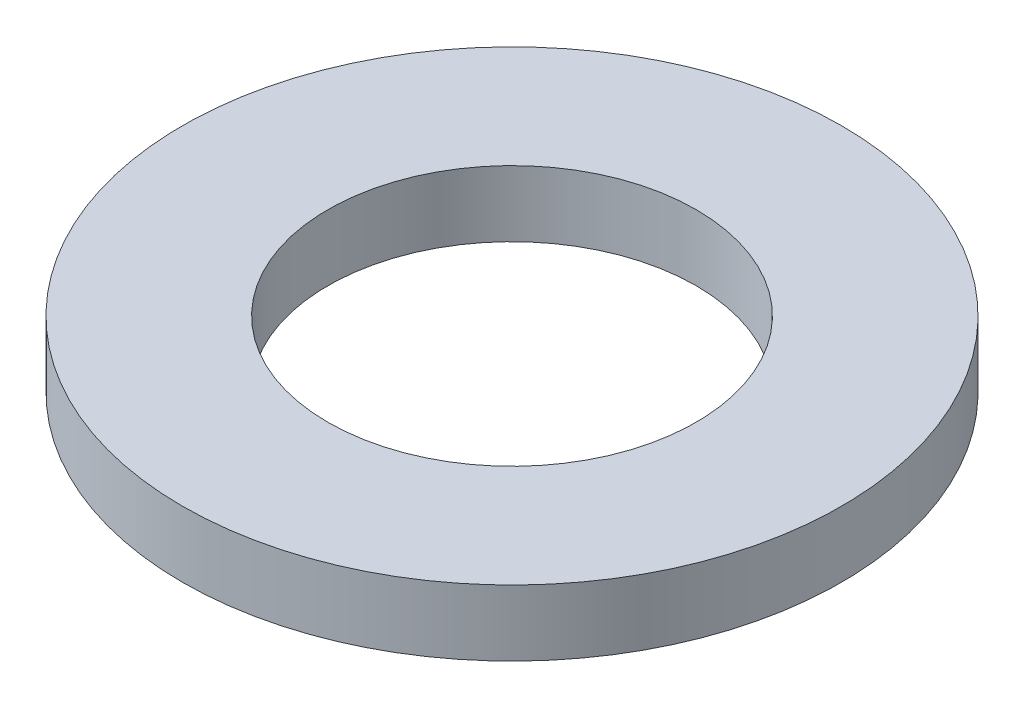
from build123d import *

# Parameters (mm, degrees)
SKETCH1_R           = 85
BOSS_EXTRUDE1_DEPTH = 17
SKETCH2_R           = 47.5
CUT_EXTRUDE1_DEPTH  = 122.404283285


with BuildPart() as part:
    # Sketch1 → Boss-Extrude1 (new body)
    with BuildSketch(Plane(origin=(0, 0, 0), x_dir=(1, 0, 0), z_dir=(0, 1, 0))):
        Circle(SKETCH1_R)
    extrude(amount=BOSS_EXTRUDE1_DEPTH)

    # Sketch2 → Cut-Extrude1 (cut, through all)
    with BuildSketch(Plane(origin=(0, 0, 0), x_dir=(1, 0, 0), z_dir=(0, 1, 0))):
        Circle(SKETCH2_R)
    extrude(amount=CUT_EXTRUDE1_DEPTH, mode=Mode.SUBTRACT)


solid = part.part
